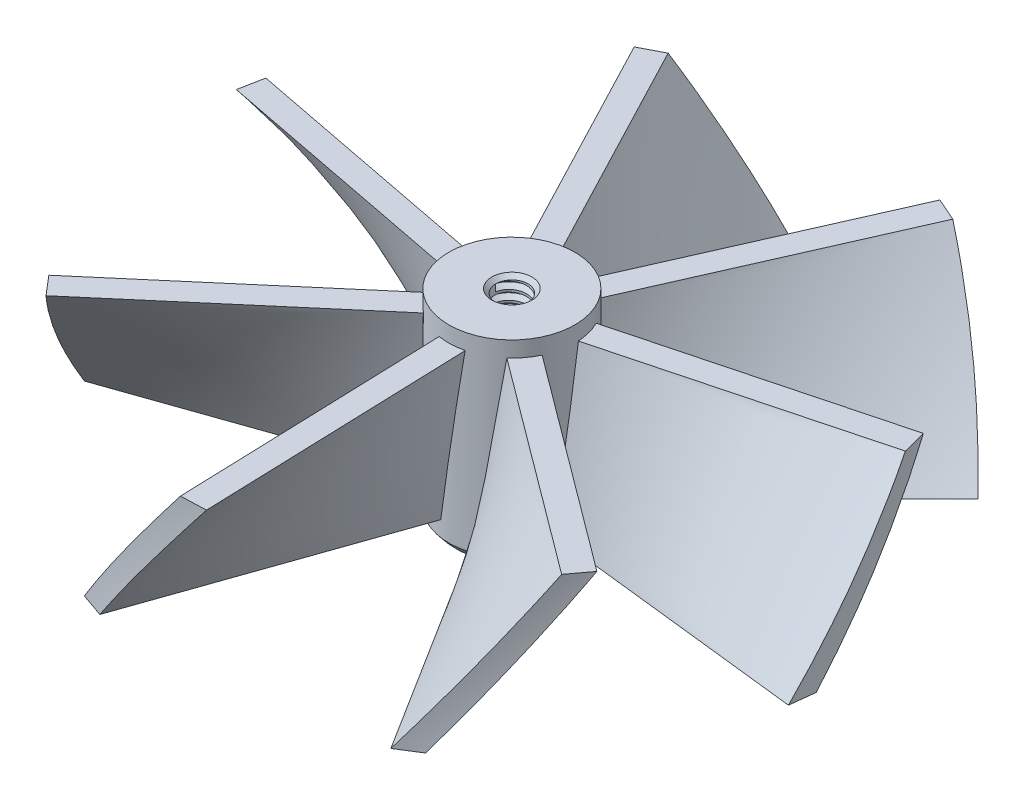
from build123d import *

# Parameters (mm, degrees)
SKETCH_1_R                     = 4
EXTRUDE_1_DEPTH                = 12
HOLE_WIZARD_M2_5_1_D           = 2.05
HOLE_WIZARD_M2_5_1_DEPTH       = 5
HOLE_WIZARD_M2_5_1_CSINK_D     = 2.55
HOLE_WIZARD_M2_5_1_CSINK_ANGLE = 90
HOLE_WIZARD_M2_5_1_TIP         = 0.615882135
THREAD_1_PITCH                 = 0.6
SWEEP_7_PITCH                  = 170
PATTERN_CIRCULAR_3_COUNT       = 7


with BuildPart() as part:
    # 草图1 → 凸台-拉伸1 (new body)
    with BuildSketch(Plane(origin=(0, 0, 0), x_dir=(1, 0, 0), z_dir=(0, 1, 0))):
        with Locations(Location((0, 0, 0), (0, 0, 270))):
            Circle(SKETCH_1_R)
    extrude(amount=EXTRUDE_1_DEPTH)

    # M2.5 螺纹孔1
    with Locations(Plane.ZX.offset(12)):
        with Locations((0, 0)):
            CounterSinkHole(HOLE_WIZARD_M2_5_1_D / 2, HOLE_WIZARD_M2_5_1_CSINK_D / 2, depth=HOLE_WIZARD_M2_5_1_DEPTH, counter_sink_angle=HOLE_WIZARD_M2_5_1_CSINK_ANGLE)
            with Locations((0, 0, -(HOLE_WIZARD_M2_5_1_DEPTH + HOLE_WIZARD_M2_5_1_TIP / 2))):  # 118° drill point
                Cone(0, HOLE_WIZARD_M2_5_1_D / 2, HOLE_WIZARD_M2_5_1_TIP, mode=Mode.SUBTRACT)

    # 螺纹线1: the profile of Sketch 2 profile screwed along a right-hand helix of 8.333333 turns, 6 arcs to a turn; built about Z, then put on its axis
    thread_1_z = Axis((0, 0, 0), (0, 0, 1))
    thread_1_corners = [(1.0247, 0, -0.000173205), (1.349759525, 0, 0.187499999), (1.349759525, 0, 0.262499999), (1.0247, 0, 0.450173203)]
    with BuildLine(mode=Mode.PRIVATE) as thread_1_profile:
        Line(thread_1_corners[0], thread_1_corners[1])
        Line(thread_1_corners[1], thread_1_corners[2])
        Line(thread_1_corners[2], thread_1_corners[3])
        Line(thread_1_corners[3], thread_1_corners[0])
    thread_1_cap = Face(thread_1_profile.wire())
    thread_1_turn_angles = [0, 30, 60, 90, 120, 150, 180, 210, 240, 270, 300, 330, 360]
    thread_1_turn_weights = [1, 0.8660254037844387, 1, 0.8660254037844387, 1, 0.8660254037844387, 1, 0.8660254037844387, 1, 0.8660254037844387, 1, 0.8660254037844387, 1]
    thread_1_turn_rails = [Edge.make_bspline([Vector(p[0], p[1], 0).rotate(thread_1_z, thread_1_turn_angles[k]) / thread_1_turn_weights[k] + Vector(0, 0, p[2] + THREAD_1_PITCH * thread_1_turn_angles[k] / 360) for k in range(13)], [0, 0, 0, 1, 1, 2, 2, 3, 3, 4, 4, 5, 5, 6, 6, 6], 2, thread_1_turn_weights) for p in thread_1_corners]
    thread_1_turn_sides = [Face.make_surface_from_curves(thread_1_turn_rails[p[0]], thread_1_turn_rails[p[1]]) for p in [(0, 1), (1, 2), (2, 3), (3, 0)]]
    thread_1_last_angles = [2880, 2910, 2940, 2970, 3000]
    thread_1_last_weights = [1, 0.8660254037844387, 1, 0.8660254037844387, 1]
    thread_1_last_rails = [Edge.make_bspline([Vector(p[0], p[1], 0).rotate(thread_1_z, thread_1_last_angles[k]) / thread_1_last_weights[k] + Vector(0, 0, p[2] + THREAD_1_PITCH * thread_1_last_angles[k] / 360) for k in range(5)], [0, 0, 0, 1, 1, 2, 2, 2], 2, thread_1_last_weights) for p in thread_1_corners]
    thread_1_last_sides = [Face.make_surface_from_curves(thread_1_last_rails[p[0]], thread_1_last_rails[p[1]]) for p in [(0, 1), (1, 2), (2, 3), (3, 0)]]
    thread_1 = Plane(origin=(0, 11.75, 0), x_dir=(-1, 0, 0), z_dir=(0, -1, 0)) * Solid(Shell([*[p.moved(Location((0, 0, THREAD_1_PITCH * i))) for i in range(8) for p in thread_1_turn_sides], *thread_1_last_sides, thread_1_cap, thread_1_cap.rotate(thread_1_z, 3000).moved(Location((0, 0, THREAD_1_PITCH * 3000 / 360)))]))
    add(thread_1, mode=Mode.SUBTRACT)

    # 扫描7: the profile of 草图15 screwed along a right-hand helix of 0.058824 turns, 40 arcs to a turn; built about Z, then put on its axis
    sweep_7_z = Axis((0, 0, 0), (0, 0, 1))
    sweep_7_corners = [(3.927827045, 0.8, 0), (20.927827045, 0.8, 0), (20.927827045, -0.8, 0), (3.927827045, -0.8, 0)]
    with BuildLine(mode=Mode.PRIVATE) as sweep_7_profile:
        Line(sweep_7_corners[0], sweep_7_corners[1])
        Line(sweep_7_corners[1], sweep_7_corners[2])
        Line(sweep_7_corners[2], sweep_7_corners[3])
        Line(sweep_7_corners[3], sweep_7_corners[0])
    sweep_7_cap = Face(sweep_7_profile.wire())
    sweep_7_turn_angles = [0, 4.5, 9, 13.5, 18, 19.588235294, 21.176470588]
    sweep_7_turn_weights = [1, 0.996917333733128, 1, 0.996917333733128, 1, 0.9996158271974874, 1]
    sweep_7_turn_rails = [Edge.make_bspline([Vector(p[0], p[1], 0).rotate(sweep_7_z, sweep_7_turn_angles[k]) / sweep_7_turn_weights[k] + Vector(0, 0, p[2] + SWEEP_7_PITCH * sweep_7_turn_angles[k] / 360) for k in range(7)], [0, 0, 0, 1, 1, 2, 2, 3, 3, 3], 2, sweep_7_turn_weights) for p in sweep_7_corners]
    sweep_7_turn_sides = [Face.make_surface_from_curves(sweep_7_turn_rails[p[0]], sweep_7_turn_rails[p[1]]) for p in [(0, 1), (1, 2), (2, 3), (3, 0)]]
    sweep_7 = Plane(origin=(0, 1, 0), x_dir=(0.7071067811865488, 0, -0.7071067811865464), z_dir=(0, 1, 0)) * Solid(Shell([*sweep_7_turn_sides, sweep_7_cap, sweep_7_cap.rotate(sweep_7_z, 21.176470588).moved(Location((0, 0, SWEEP_7_PITCH * 21.176470588 / 360)))]))
    add(sweep_7)

    # 阵列(圆周)3: 扫描7 ×7 about axis
    pattern_circular_3_axis = Axis((0, 12, 0), (0, 1, 0))
    for i in range(1, PATTERN_CIRCULAR_3_COUNT):
        add(sweep_7.rotate(pattern_circular_3_axis, i * 360 / PATTERN_CIRCULAR_3_COUNT))

    # 草图30 → 旋转2 (revolve)
    with BuildSketch(Plane.XY, mode=Mode.PRIVATE) as revolve_2_sk:
        with BuildLine():
            Line((0, 0), (0, -2))
            add(Edge.make_bspline(
                [(-4, 0), (-2.731341584, -1.796381272), (0, -2)],
                knots=[0, 0, 0, 1, 1, 1], degree=2))
            Line((-4, 0), (0, 0))
        make_face()
    revolve(revolve_2_sk.sketch.rotate(Axis((0, 0, 0), (0, -1, 0)), 270), axis=Axis((0, 0, 0), (0, -1, 0)))


solid = part.part
